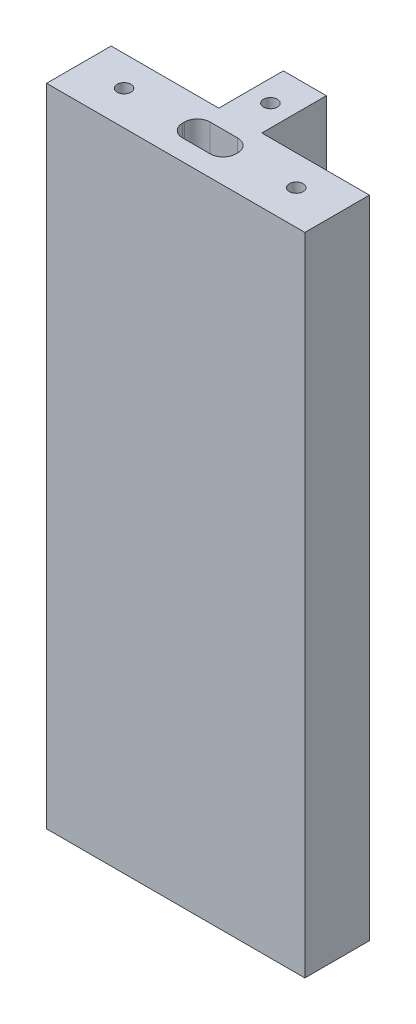
from build123d import *

# Parameters (mm, degrees)
BOSS_EXTRUDE1_DEPTH        = 37.5
SKETCH2_W                  = 6.2
SKETCH2_H                  = 3.2
CUT_EXTRUDE1_DEPTH         = 6.2
FILLET1_R                  = 1.5
M2_TAPPED_HOLE1_AT_2_COUNT = 2
M2_TAPPED_HOLE1_AT_2_PITCH = 12.206555616
M2_TAPPED_HOLE1_AT_3_COUNT = 2
M2_TAPPED_HOLE1_AT_3_PITCH = 20
FILLET1_OF_MIRROR1_R       = 1.5


with BuildPart() as part:
    # Sketch1 → Boss-Extrude1 (new, symmetric)
    with BuildSketch(Plane(origin=(0, 0, 0), x_dir=(1, 0, 0), z_dir=(0, 1, 0))):
        Polygon((-15, 0), (15, 0), (15, 7.5), (2.5, 7.5), (2.5, 15), (-2.5, 15), (-2.5, 7.5), (-15, 7.5), align=None)
    extrude(amount=BOSS_EXTRUDE1_DEPTH, both=True)

    # Sketch2 → Cut-Extrude1 (cut)
    with BuildSketch(Plane.XZ.offset(37.5)):
        with Locations((0, -4)):
            Rectangle(SKETCH2_W, SKETCH2_H)
    cut_extrude1 = extrude(amount=-CUT_EXTRUDE1_DEPTH, mode=Mode.SUBTRACT)

    # Fillet1
    fillet1_edges = [part.edges().sort_by_distance(p)[0] for p in [
        (3.1, -34.4, -5.6),
        (3.1, -34.4, -2.4),
        (-3.1, -34.4, -5.6),
        (-3.1, -34.4, -2.4),
    ]]
    fillet(fillet1_edges, radius=FILLET1_R)

    # Sketch6 → M2 Tapped Hole1 (revolve, cut)
    with BuildSketch(Plane(origin=(-10, -37.5, -4), x_dir=(0, 0, -1), z_dir=(1, 0, 0))):
        Polygon((0, 0), (0, 5.680688495), (0.8, 5.2), (0.8, 0), align=None)
    m2_tapped_hole1 = revolve(axis=Axis((-10, -43.85, -4), (0, 1, 0)), mode=Mode.SUBTRACT)

    # M2 Tapped Hole1 at 2: M2 Tapped Hole1 ×2
    with Locations(*[Vector(0.8192319205190405, 0, -0.5734623443633284) * (i * M2_TAPPED_HOLE1_AT_2_PITCH) for i in range(1, M2_TAPPED_HOLE1_AT_2_COUNT)]):
        add(m2_tapped_hole1, mode=Mode.SUBTRACT)

    # M2 Tapped Hole1 at 3: M2 Tapped Hole1 ×2
    with Locations(*[(i * M2_TAPPED_HOLE1_AT_3_PITCH, 0, 0) for i in range(1, M2_TAPPED_HOLE1_AT_3_COUNT)]):
        add(m2_tapped_hole1, mode=Mode.SUBTRACT)

    # Mirror1: Cut-Extrude1, M2 Tapped Hole1 across plane
    add(cut_extrude1.mirror(Plane.ZX), mode=Mode.SUBTRACT)
    add(m2_tapped_hole1.mirror(Plane.ZX), mode=Mode.SUBTRACT)

    # Mirror1 copy 1 sketch → Mirror1 copy 1 (revolve, cut)
    with BuildSketch(Plane(origin=(0, 37.5, -11), x_dir=(0, 0, -1), z_dir=(1, 0, 0))):
        Polygon((0, 0), (0, -5.680688495), (0.8, -5.2), (0.8, 0), align=None)
    revolve(axis=Axis((0, 43.85, -11), (0, 1, 0)), mode=Mode.SUBTRACT)

    # Mirror1 copy 2 sketch → Mirror1 copy 2 (revolve, cut)
    with BuildSketch(Plane(origin=(10, 37.5, -4), x_dir=(0, 0, -1), z_dir=(1, 0, 0))):
        Polygon((0, 0), (0, -5.680688495), (0.8, -5.2), (0.8, 0), align=None)
    revolve(axis=Axis((10, 43.85, -4), (0, 1, 0)), mode=Mode.SUBTRACT)

    # Fillet1 of Mirror1
    fillet1_of_mirror1_edges = [part.edges().sort_by_distance(p)[0] for p in [
        (3.1, 34.4, -5.6),
        (3.1, 34.4, -2.4),
        (-3.1, 34.4, -5.6),
        (-3.1, 34.4, -2.4),
    ]]
    fillet(fillet1_of_mirror1_edges, radius=FILLET1_OF_MIRROR1_R)


solid = part.part
